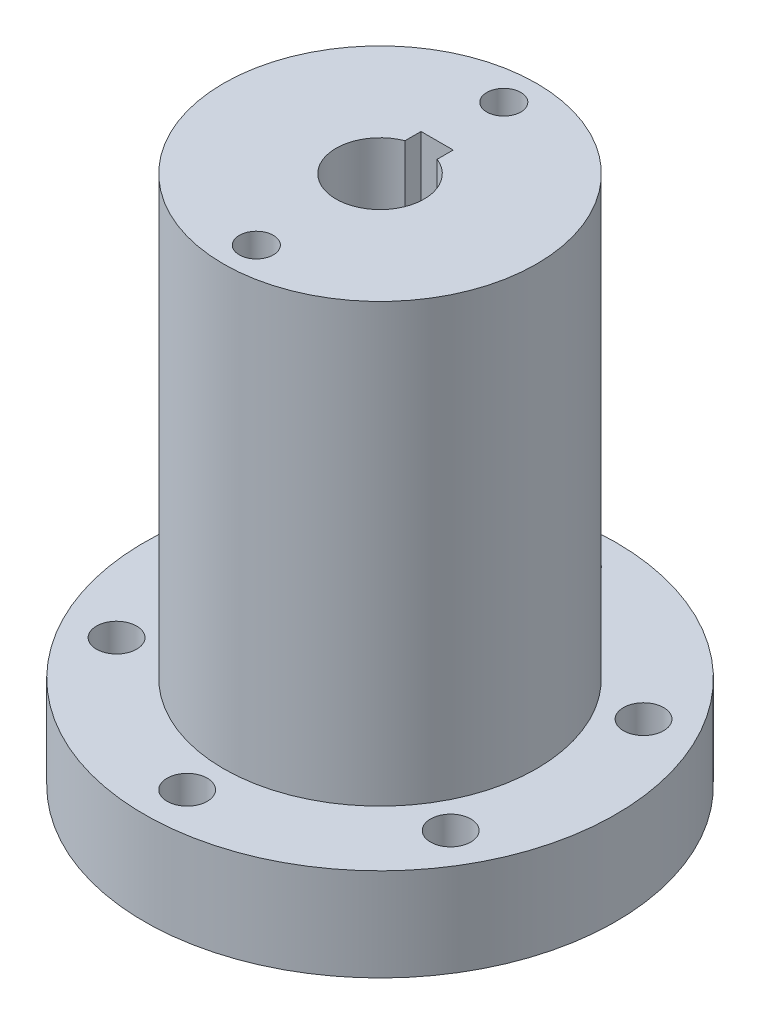
from build123d import *

# Parameters (mm, degrees)
SKETCH1_R           = 25.3
BOSS_EXTRUDE1_DEPTH = 8.5
SKETCH2_R           = 25.3
BOSS_EXTRUDE2_DEPTH = 57.15
SKETCH7_R           = 25.3
BOSS_EXTRUDE4_DEPTH = 15
CUT_EXTRUDE3_DEPTH  = 115
SKETCH6_R           = 38.1
BOSS_EXTRUDE3_DEPTH = 15
SKETCH9_R           = 3.25
CUT_EXTRUDE4_DEPTH  = 20
SKETCH10_R          = 2.75
CUT_EXTRUDE6_DEPTH  = 129
BOSS_EXTRUDE5_START = -93
BOSS_EXTRUDE5_DEPTH = 93
CUT_EXTRUDE8_START  = -10
SKETCH12_R          = 25.3
CUT_EXTRUDE8_DEPTH  = 10
CUT_EXTRUDE9_DEPTH  = 30


with BuildPart() as part:
    # Sketch1 → Boss-Extrude1 (new body)
    with BuildSketch(Plane(origin=(0, 0, 0), x_dir=(1, 0, 0), z_dir=(0, 1, 0))):
        Circle(SKETCH1_R)
    extrude(amount=BOSS_EXTRUDE1_DEPTH)

    # Sketch2 → Boss-Extrude2 (add)
    with BuildSketch(Plane(origin=(0, 8.5, 0), x_dir=(1, 0, 0), z_dir=(0, 1, 0))):
        Circle(SKETCH2_R)
    extrude(amount=BOSS_EXTRUDE2_DEPTH)

    # Sketch7 → Boss-Extrude4 (add)
    with BuildSketch(Plane(origin=(0, 65.65, 0), x_dir=(1, 0, 0), z_dir=(0, 1, 0))):
        Circle(SKETCH7_R)
    extrude(amount=BOSS_EXTRUDE4_DEPTH)

    # Sketch5 → Cut-Extrude3 (cut)
    with BuildSketch(Plane.XZ):
        with BuildLine():
            Line((2.575, 9.15), (-2.575, 9.15))
            Line((-2.575, 9.15), (-2.575, 6.777305881))
            ThreePointArc((-2.575, 6.777305881), (0, -7.25), (2.575, 6.777305881))
            Line((2.575, 6.777305881), (2.575, 9.15))
        make_face()
    extrude(amount=-CUT_EXTRUDE3_DEPTH, mode=Mode.SUBTRACT)

    # Sketch6 → Boss-Extrude3 (add)
    with BuildSketch(Plane.XZ):
        Circle(SKETCH6_R)
    extrude(amount=BOSS_EXTRUDE3_DEPTH)

    # Sketch9 → Cut-Extrude4 (cut)
    with BuildSketch(Plane(origin=(0, 0, 0), x_dir=(1, 0, 0), z_dir=(0, 1, 0))):
        with Locations((0, 31.176914536)):
            Circle(SKETCH9_R)
        with Locations((-27, 15.588457268)):
            Circle(SKETCH9_R)
        with Locations((27, 15.588457268)):
            Circle(SKETCH9_R)
        with Locations((-27, -15.588457268)):
            Circle(SKETCH9_R)
        with Locations((27, -15.588457268)):
            Circle(SKETCH9_R)
        with Locations((0, -31.176914536)):
            Circle(SKETCH9_R)
    extrude(amount=-CUT_EXTRUDE4_DEPTH, mode=Mode.SUBTRACT)

    # Sketch10 → Cut-Extrude6 (cut)
    with BuildSketch(Plane(origin=(0, 80.65, 0), x_dir=(1, 0, 0), z_dir=(0, 1, 0))):
        with Locations((0, 20)):
            Circle(SKETCH10_R)
        with Locations((0, -20)):
            Circle(SKETCH10_R)
    extrude(amount=-CUT_EXTRUDE6_DEPTH, mode=Mode.SUBTRACT)

    # Sketch11 → Boss-Extrude5 (add)
    with BuildSketch(Plane(origin=(0, 80.65, 0), x_dir=(1, 0, 0), z_dir=(0, 1, 0)).offset(BOSS_EXTRUDE5_START)):
        with BuildLine():
            Line((-2.575, -6.777305881), (-2.575, -9.15))
            Line((-2.575, -9.15), (0, -9.15))
            Line((0, -9.15), (2.575, -9.15))
            Line((2.575, -9.15), (2.575, -6.777305881))
            ThreePointArc((2.575, -6.777305881), (0, 7.25), (-2.575, -6.777305881))
        make_face()
    extrude(amount=BOSS_EXTRUDE5_DEPTH)

    # Sketch12 → Cut-Extrude8 (cut)
    with BuildSketch(Plane(origin=(0, 80.65, 0), x_dir=(1, 0, 0), z_dir=(0, 1, 0)).offset(CUT_EXTRUDE8_START)):
        Circle(SKETCH12_R)
    extrude(amount=CUT_EXTRUDE8_DEPTH, mode=Mode.SUBTRACT)

    # Sketch13 → Cut-Extrude9 (cut)
    with BuildSketch(Plane(origin=(0, 70.65, 0), x_dir=(1, 0, 0), z_dir=(0, 1, 0))):
        with BuildLine():
            Line((-2.6, 9.22), (-2.6, 6.62830295))
            ThreePointArc((-2.6, 6.62830295), (0, -7.12), (2.6, 6.62830295))
            Line((2.6, 6.62830295), (2.6, 9.22))
            Line((2.6, 9.22), (-2.6, 9.22))
        make_face()
    extrude(amount=-CUT_EXTRUDE9_DEPTH, mode=Mode.SUBTRACT)


solid = part.part
